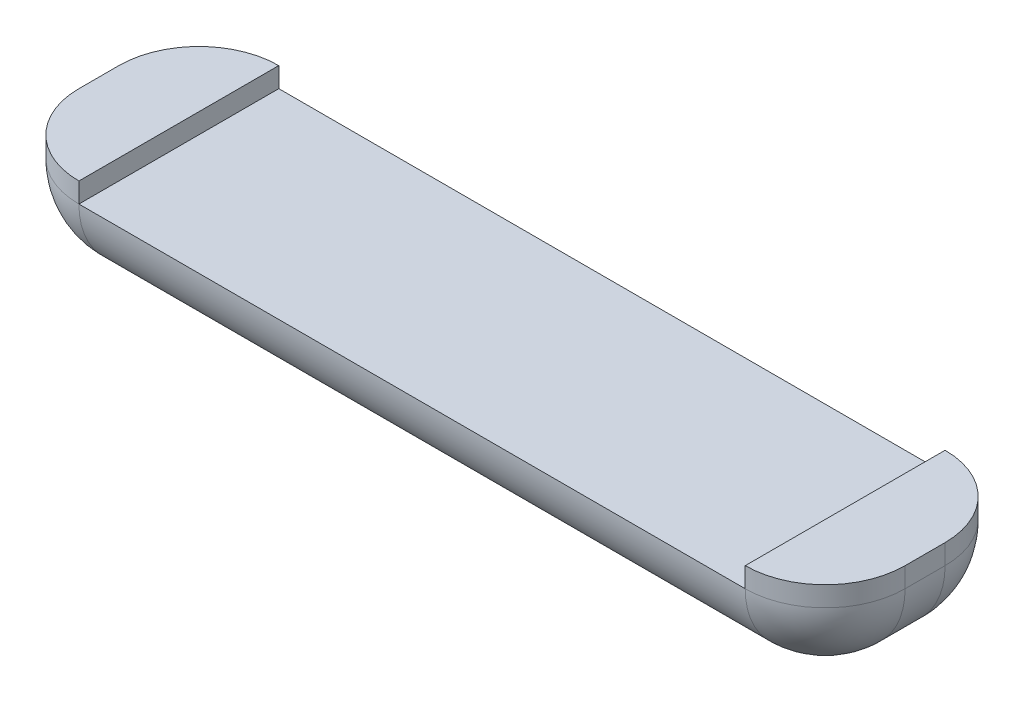
from build123d import *

# Parameters (mm, degrees)
BOSS_EXTRUDE1_DEPTH = 62
FILLET1_R           = 6
FILLET2_R           = 6
CAVITY1_START       = -1.5
CAVITY1_OUTLINE_W   = 50
CAVITY1_OUTLINE_H   = 15
CAVITY1_DEPTH       = 3
SKETCH2_W           = 132.712401986
SKETCH2_H           = 25.545070458
CUT_EXTRUDE1_DEPTH  = 10


# Read off the part's stored shape, not the designer's step: Cavity1
with BuildPart() as part:
    # Sketch1 → Boss-Extrude1 (new body)
    with BuildSketch(Plane(origin=(0, 0, 0), x_dir=(0, 0, -1), z_dir=(1, 0, 0))):
        with BuildLine():
            Line((-1.5, -7.5), (1.5, -7.5))
            ThreePointArc((1.5, -7.5), (5.742640687, -5.742640687), (7.5, -1.5))
            Line((7.5, -1.5), (7.5, 1.5))
            ThreePointArc((7.5, 1.5), (5.742640687, 5.742640687), (1.5, 7.5))
            Line((1.5, 7.5), (-1.5, 7.5))
            ThreePointArc((-1.5, 7.5), (-5.742640687, 5.742640687), (-7.5, 1.5))
            Line((-7.5, 1.5), (-7.5, -1.5))
            ThreePointArc((-7.5, -1.5), (-5.742640687, -5.742640687), (-1.5, -7.5))
        make_face()
    extrude(amount=BOSS_EXTRUDE1_DEPTH)

    # Fillet1
    fillet1_edges = [part.edges().sort_by_distance(p)[0] for p in [
        (0, 7.5, 0),
        (0, 5.742640687, -5.742640687),
        (0, 0, -7.5),
        (0, -5.742640687, -5.742640687),
        (0, -7.5, 0),
        (0, -5.742640687, 5.742640687),
        (0, 0, 7.5),
        (0, 5.742640687, 5.742640687),
    ]]
    fillet(fillet1_edges, radius=FILLET1_R)

    # Fillet2
    fillet2_edges = [part.edges().sort_by_distance(p)[0] for p in [
        (62, 5.742640687, -5.742640687),
        (62, 7.5, 0),
        (62, 5.742640687, 5.742640687),
        (62, 0, 7.5),
        (62, -5.742640687, 5.742640687),
        (62, -7.5, 0),
        (62, -5.742640687, -5.742640687),
        (62, 0, -7.5),
    ]]
    fillet(fillet2_edges, radius=FILLET2_R)

    # Cavity1 outline → Cavity1 (cut)
    with BuildSketch(Plane(origin=(0, 0, 0), x_dir=(1, 0, 0), z_dir=(0, 1, 0)).offset(CAVITY1_START)):
        with Locations((31, 0)):
            Rectangle(CAVITY1_OUTLINE_W, CAVITY1_OUTLINE_H)
    extrude(amount=CAVITY1_DEPTH, mode=Mode.SUBTRACT)

    # Sketch2 → Cut-Extrude1 (cut)
    with BuildSketch(Plane(origin=(0, 0, 0), x_dir=(1, 0, 0), z_dir=(0, 1, 0))):
        Rectangle(SKETCH2_W, SKETCH2_H)
    extrude(amount=CUT_EXTRUDE1_DEPTH, mode=Mode.SUBTRACT)


solid = part.part
